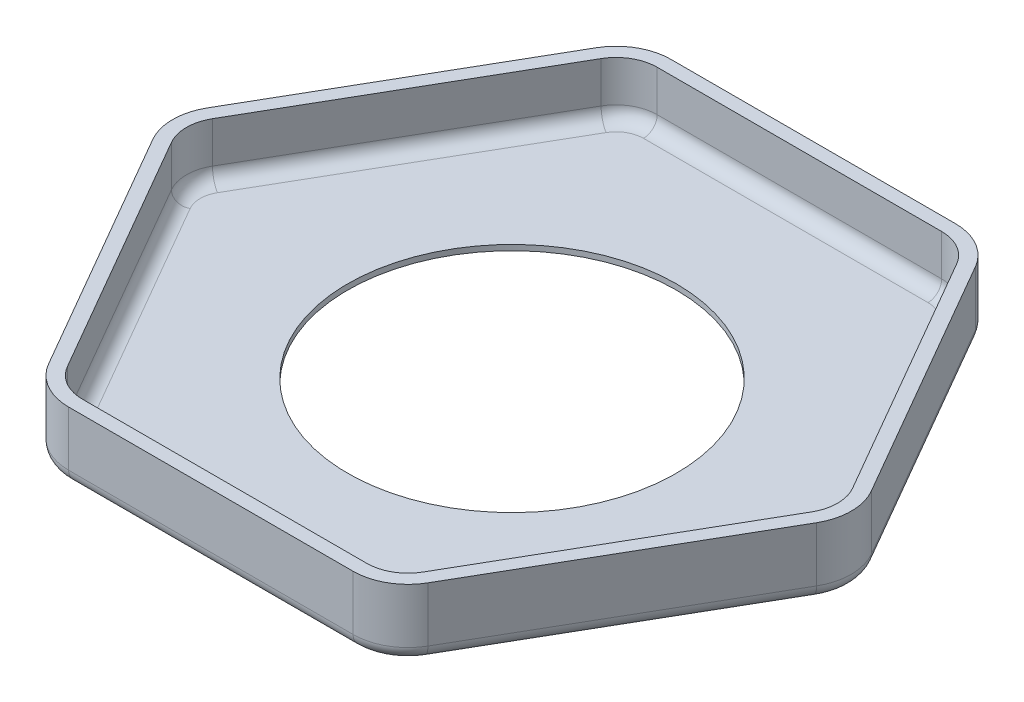
from build123d import *

# Parameters (mm, degrees)
SALIENTE_EXTRUIR2_DEPTH = 5
SALIENTE_EXTRUIR3_DEPTH = 20
REDONDEO2_R             = 5
REDONDEO3_R             = 5
CROQUIS4_R              = 60
CORTAR_EXTRUIR1_DEPTH   = 10
CROQUIS3_R              = 90
CORTAR_EXTRUIR2_DEPTH   = 3


with BuildPart() as part:
    # Croquis1 → Saliente-Extruir2 (new body)
    with BuildSketch(Plane(origin=(0, 0, 0), x_dir=(1, 0, 0), z_dir=(0, 1, 0))):
        with BuildLine():
            Line((-119.224191345, -9.394190445), (-67.262667118, -99.394190445))
            ThreePointArc((-67.262667118, -99.394190445), (-59.942159042, -106.71469852), (-49.942159042, -109.394190445))
            Line((-49.942159042, -109.394190445), (53.980889412, -109.394190445))
            ThreePointArc((53.980889412, -109.394190445), (63.980889412, -106.71469852), (71.301397487, -99.394190445))
            Line((71.301397487, -99.394190445), (123.262921714, -9.394190445))
            ThreePointArc((123.262921714, -9.394190445), (125.942413639, 0.605809555), (123.262921714, 10.605809555))
            Line((123.262921714, 10.605809555), (71.301397487, 100.605809555))
            ThreePointArc((71.301397487, 100.605809555), (63.980889412, 107.926317631), (53.980889412, 110.605809555))
            Line((53.980889412, 110.605809555), (-49.942159042, 110.605809555))
            ThreePointArc((-49.942159042, 110.605809555), (-59.942159042, 107.926317631), (-67.262667118, 100.605809555))
            Line((-67.262667118, 100.605809555), (-119.224191345, 10.605809555))
            ThreePointArc((-119.224191345, 10.605809555), (-121.90368327, 0.605809555), (-119.224191345, -9.394190445))
        make_face()
    extrude(amount=SALIENTE_EXTRUIR2_DEPTH)

    # Croquis2 → Saliente-Extruir3 (add)
    with BuildSketch(Plane(origin=(0, 5, 0), x_dir=(1, 0, 0), z_dir=(0, 1, 0))):
        with BuildLine():
            Line((-67.262667118, 100.605809555), (-119.224191345, 10.605809555))
            ThreePointArc((-119.224191345, 10.605809555), (-121.90368327, 0.605809555), (-119.224191345, -9.394190445))
            Line((-119.224191345, -9.394190445), (-67.262667118, -99.394190445))
            ThreePointArc((-67.262667118, -99.394190445), (-59.942159042, -106.71469852), (-49.942159042, -109.394190445))
            Line((-49.942159042, -109.394190445), (53.980889412, -109.394190445))
            ThreePointArc((53.980889412, -109.394190445), (63.980889412, -106.71469852), (71.301397487, -99.394190445))
            Line((71.301397487, -99.394190445), (123.262921714, -9.394190445))
            ThreePointArc((123.262921714, -9.394190445), (125.942413639, 0.605809555), (123.262921714, 10.605809555))
            Line((123.262921714, 10.605809555), (71.301397487, 100.605809555))
            ThreePointArc((71.301397487, 100.605809555), (63.980889412, 107.926317631), (53.980889412, 110.605809555))
            Line((53.980889412, 110.605809555), (-49.942159042, 110.605809555))
            ThreePointArc((-49.942159042, 110.605809555), (-59.942159042, 107.926317631), (-67.262667118, 100.605809555))
        make_face()
        with BuildLine():
            Line((-62.932540099, 98.105809555), (-114.894064326, 8.105809555))
            ThreePointArc((-114.894064326, 8.105809555), (-116.90368327, 0.605809555), (-114.894064326, -6.894190445))
            Line((-114.894064326, -6.894190445), (-62.932540099, -96.894190445))
            ThreePointArc((-62.932540099, -96.894190445), (-57.442159042, -102.384571501), (-49.942159042, -104.394190445))
            Line((-49.942159042, -104.394190445), (53.980889412, -104.394190445))
            ThreePointArc((53.980889412, -104.394190445), (61.480889412, -102.384571501), (66.971270468, -96.894190445))
            Line((66.971270468, -96.894190445), (118.932794695, -6.894190445))
            ThreePointArc((118.932794695, -6.894190445), (120.942413639, 0.605809555), (118.932794695, 8.105809555))
            Line((118.932794695, 8.105809555), (66.971270468, 98.105809555))
            ThreePointArc((66.971270468, 98.105809555), (61.480889412, 103.596190612), (53.980889412, 105.605809555))
            Line((53.980889412, 105.605809555), (-49.942159042, 105.605809555))
            ThreePointArc((-49.942159042, 105.605809555), (-57.442159042, 103.596190612), (-62.932540099, 98.105809555))
        make_face(mode=Mode.SUBTRACT)
    extrude(amount=SALIENTE_EXTRUIR3_DEPTH)

    # Redondeo2
    redondeo2_edges = [part.edges().sort_by_distance(p)[0] for p in [
        (-93.243429232, 0, -55.605809555),
        (-121.90368327, 0, -0.605809555),
        (-93.243429232, 0, 54.394190445),
        (-59.942159042, 0, 106.71469852),
        (2.019365185, 0, 109.394190445),
        (63.980889412, 0, 106.71469852),
        (97.282159601, 0, 54.394190445),
        (125.942413639, 0, -0.605809555),
        (97.282159601, 0, -55.605809555),
        (63.980889412, 0, -107.926317631),
        (2.019365185, 0, -110.605809555),
        (-59.942159042, 0, -107.926317631),
    ]]
    fillet(redondeo2_edges, radius=REDONDEO2_R)

    # Redondeo3
    redondeo3_edges = [part.edges().sort_by_distance(p)[0] for p in [
        (61.480889412, 5, -103.596190612),
        (92.952032582, 5, -53.105809555),
        (120.942413639, 5, -0.605809555),
        (92.952032582, 5, 51.894190445),
        (61.480889412, 5, 102.384571501),
        (2.019365185, 5, 104.394190445),
        (-57.442159042, 5, 102.384571501),
        (-88.913302213, 5, 51.894190445),
        (-116.90368327, 5, -0.605809555),
        (-88.913302213, 5, -53.105809555),
        (-57.442159042, 5, -103.596190612),
        (2.019365185, 5, -105.605809555),
    ]]
    fillet(redondeo3_edges, radius=REDONDEO3_R)

    # Croquis4 → Cortar-Extruir1 (cut)
    with BuildSketch(Plane(origin=(0, 0, 0), x_dir=(-1, 0, 0), z_dir=(0, -1, 0))):
        with Locations((-2.019365185, 0.605809555)):
            Circle(CROQUIS4_R)
    extrude(amount=-CORTAR_EXTRUIR1_DEPTH, mode=Mode.SUBTRACT)

    # Croquis3 → Cortar-Extruir2 (cut)
    with BuildSketch(Plane.XZ):
        with Locations((2.019365185, -0.605809555)):
            Circle(CROQUIS3_R)
    extrude(amount=-CORTAR_EXTRUIR2_DEPTH, mode=Mode.SUBTRACT)


solid = part.part
